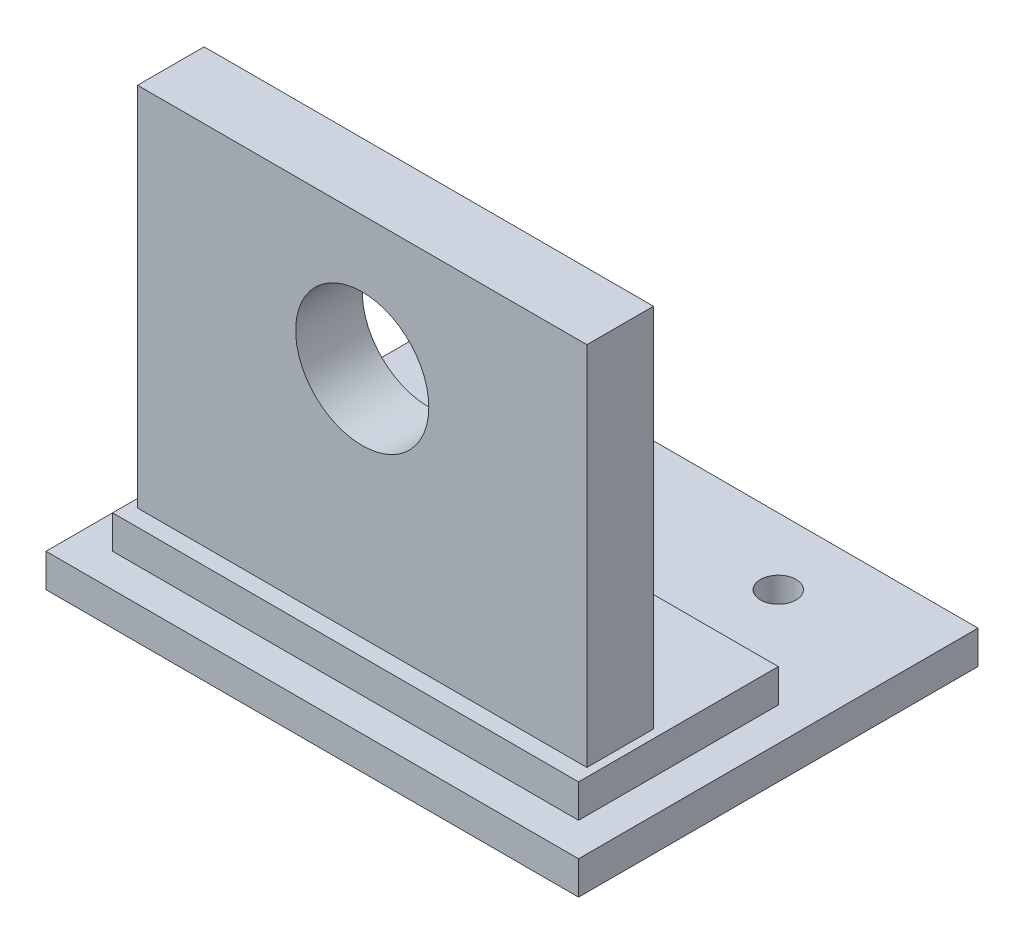
from build123d import *

# Parameters (mm, degrees)
BOSS_EXTRUDE1_DEPTH  = 3.175
SKETCH3_W            = 44.45
SKETCH3_H            = 19.05
BOSS_EXTRUDE2_DEPTH  = 3.175
SKETCH4_W            = 42.8625
SKETCH4_H            = 6.35
BOSS_EXTRUDE3_DEPTH  = 34.925
SKETCH5_R            = 6.35
CUT_EXTRUDE1_DEPTH   = 34.925
M3_CLEARANCE_HOLE1_D = 3.4


with BuildPart() as part:
    # Sketch2 → Boss-Extrude1 (new body)
    with BuildSketch(Plane(origin=(0, 0, 0), x_dir=(1, 0, 0), z_dir=(0, 1, 0))):
        Polygon((-25.4, -12.7), (25.4, -12.7), (25.4, 12.7), (25.4, 25.4), (-25.4, 25.4), (-25.4, 12.7), align=None)
    extrude(amount=BOSS_EXTRUDE1_DEPTH)

    # Sketch3 → Boss-Extrude2 (add)
    with BuildSketch(Plane(origin=(0, 3.175, 0), x_dir=(1, 0, 0), z_dir=(0, 1, 0))):
        Rectangle(SKETCH3_W, SKETCH3_H)
    extrude(amount=BOSS_EXTRUDE2_DEPTH)

    # Sketch4 → Boss-Extrude3 (add)
    with BuildSketch(Plane(origin=(0, 6.35, 0), x_dir=(1, 0, 0), z_dir=(0, 1, 0))):
        with Locations((0, -4.7625)):
            Rectangle(SKETCH4_W, SKETCH4_H)
    extrude(amount=BOSS_EXTRUDE3_DEPTH)

    # Sketch5 → Cut-Extrude1 (cut)
    with BuildSketch(Plane.XY.offset(7.9375)):
        with Locations((0, 28.575)):
            Circle(SKETCH5_R)
    extrude(amount=-CUT_EXTRUDE1_DEPTH, mode=Mode.SUBTRACT)

    # M3 Clearance Hole1 (through all)
    with Locations(Plane(origin=(-12.7, 0, -19.05), x_dir=(0, 0, -1), z_dir=(0, -1, 0))):
        with Locations((0, 0), (0, 25.4)):
            Hole(M3_CLEARANCE_HOLE1_D / 2)


solid = part.part
